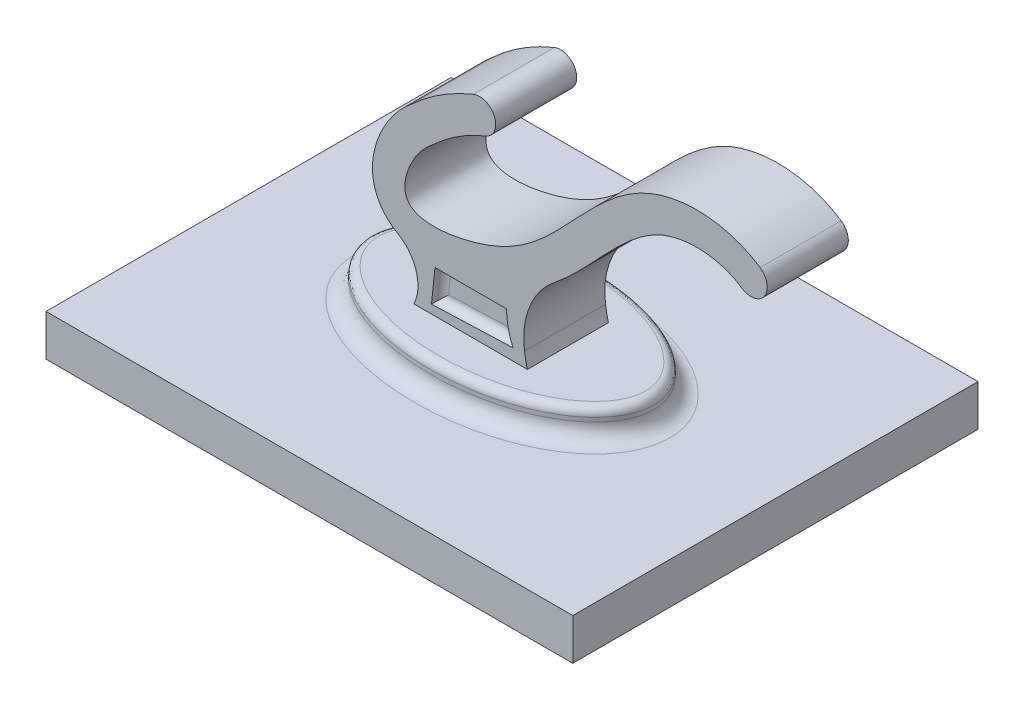
from build123d import *

# Parameters (mm, degrees)
BOSS_EXTRUDE1_DEPTH  = 5
SKETCH5_RX           = 17.5
SKETCH5_RY           = 10
BOSS_EXTRUDE4_DEPTH  = 3.5
SKETCH6_W            = 65
SKETCH6_H            = 50
BOSS_EXTRUDE5_DEPTH  = 5.10471724
CUT_EXTRUDE1_DEPTH   = 1
FILLET1_R            = 1
FILLET1_OF_MIRROR1_R = 1
FILLET2_R            = 1
FILLET3_R            = 10
FILLET4_START        = -5
FILLET4_DEPTH        = 10
FILLET5_R            = 2


with BuildPart() as part:
    # Sketch1 → Boss-Extrude1 (new, symmetric)
    with BuildSketch(Plane.XY):
        with BuildLine():
            add(Edge.make_bspline(
                [(-42.511448493, -19.515884819), (-41.183178468, -22.408372715), (-42.719767002, -25.24031189)],
                knots=[0, 0, 0, 1, 1, 1], degree=2))
            Line((-42.719767002, -25.24031189), (-28.710720076, -25.24031189))
            add(Edge.make_bspline(
                [(-27.547491004, -15.847538406), (-30.069104559, -20.108010021), (-28.710720076, -25.24031189)],
                knots=[0, 0, 0, 1, 1, 1], degree=2))
            add(Edge.make_bspline(
                [(-27.547491004, -15.847538406), (-27.693107353, -15.940822385), (-28.264730213, -16.298269412), (-29.483664506, -16.989369815), (-31.316256526, -17.843251684), (-33.534401516, -18.635056766), (-35.988441983, -19.283375181), (-38.642792909, -19.720500928), (-40.699902189, -19.779860279), (-42.024180926, -19.60949801), (-42.386794513, -19.541847042), (-42.511448493, -19.515884819)],
                knots=[0.56300718, 0.56300718, 0.56300718, 0.56300718, 0.570033901, 0.590244602, 0.618351488, 0.646458373, 0.674565259, 0.702672145, 0.730779031, 0.737565281, 0.741078642, 0.741078642, 0.741078642, 0.741078642], degree=3))
        make_face()
        with BuildLine():
            add(Edge.make_bspline(
                [(-42.511448493, -19.515884819), (-42.636102473, -19.489922596), (-42.887331899, -19.432227341), (-43.534661604, -19.253424197), (-44.597666409, -18.842797427), (-45.836596941, -18.006002518), (-46.772453373, -16.905139633), (-47.325073442, -15.921415058), (-47.663037862, -14.901222088), (-47.868098427, -13.630186416), (-47.813550522, -12.189145316), (-47.470372263, -10.624757554), (-46.924943549, -9.151691323), (-46.206717395, -7.746849394), (-45.322180994, -6.407972591), (-44.276311696, -5.156830424), (-43.437940558, -4.381521508), (-42.99756659, -4.032031584)],
                knots=[0.741078642, 0.741078642, 0.741078642, 0.741078642, 0.744592003, 0.748105363, 0.758885917, 0.772939359, 0.779966081, 0.786992802, 0.794019524, 0.801046245, 0.815099688, 0.829153131, 0.843206574, 0.857260017, 0.87131346, 0.885366903, 0.899420346, 0.899420346, 0.899420346, 0.899420346], degree=3))
            add(Edge.make_bspline(
                [(-27.547491004, -15.847538406), (-27.693107353, -15.940822385), (-28.264730213, -16.298269412), (-29.483664506, -16.989369815), (-31.316256526, -17.843251684), (-33.534401516, -18.635056766), (-35.988441983, -19.283375181), (-38.642792909, -19.720500928), (-40.699902189, -19.779860279), (-42.024180926, -19.60949801), (-42.386794513, -19.541847042), (-42.511448493, -19.515884819)],
                knots=[0.56300718, 0.56300718, 0.56300718, 0.56300718, 0.570033901, 0.590244602, 0.618351488, 0.646458373, 0.674565259, 0.702672145, 0.730779031, 0.737565281, 0.741078642, 0.741078642, 0.741078642, 0.741078642], degree=3))
            add(Edge.make_bspline(
                [(-2.224344566, -3.324498647), (-2.905624006, -2.868670451), (-4.376185748, -2.166937835), (-6.967392616, -1.663778837), (-9.668441391, -1.791572405), (-11.77198919, -2.389283508), (-13.297394838, -3.145944029), (-14.84863169, -4.131922848), (-16.797206994, -5.756193498), (-19.166707895, -8.167579935), (-21.614042986, -10.80849673), (-24.154437177, -13.337237691), (-26.233964049, -14.987750414), (-27.401874655, -15.754254427), (-27.547491004, -15.847538406)],
                knots=[0, 0, 0, 0, 0.056213772, 0.112427543, 0.168641315, 0.224855086, 0.252961972, 0.281068858, 0.33728263, 0.393496401, 0.449710173, 0.505923944, 0.555980458, 0.56300718, 0.56300718, 0.56300718, 0.56300718], degree=3))
            ThreePointArc((-2.224344566, -3.324498647), (0.55007704, -2.774421606), (0, 0))
            add(Edge.make_bspline(
                [(0, 0), (-3.995592997, 2.673358156), (-15.180096214, 3.17032538), (-24.42498552, -8.673292233), (-32.617415365, -15.187584878), (-44.458031911, -16.548233458), (-43.627257657, -10.773066777), (-41.633524958, -8.018810006), (-40.398542985, -7.077773665)],
                knots=[0, 0, 0, 0, 0.226825743, 0.465308755, 0.653750379, 0.78709749, 0.842182254, 0.90122142, 0.90122142, 0.90122142, 0.90122142], degree=3))
            add(Edge.make_bspline(
                [(-40.398542985, -7.077773665), (-37.497279915, -4.350318758), (-33.872206444, -2.876080959)],
                knots=[0, 0, 0, 1, 1, 1], degree=2))
            ThreePointArc((-33.872206444, -2.876080959), (-32.77298467, -0.26998973), (-35.379075899, 0.829232044))
            add(Edge.make_bspline(
                [(-42.99756659, -4.032031584), (-39.614957302, -0.896777436), (-35.379075899, 0.829232044)],
                knots=[0.02053743, 0.02053743, 0.02053743, 1, 1, 1], degree=2))
        make_face()
    extrude(amount=BOSS_EXTRUDE1_DEPTH, both=True)

    # Sketch5 → Boss-Extrude4 (add)
    with BuildSketch(Plane.XZ.offset(25.24031189)):
        with Locations(Location((-35.611084284, 0), (0, 0, 0))):
            Ellipse(SKETCH5_RX, SKETCH5_RY)
    extrude(amount=BOSS_EXTRUDE4_DEPTH)

    # Sketch6 → Boss-Extrude5 (add)
    with BuildSketch(Plane(origin=(0, -28.74031189, 0), x_dir=(-1, 0, 0), z_dir=(0, -1, 0))):
        with Locations((35.611084284, 0)):
            Rectangle(SKETCH6_W, SKETCH6_H)
    extrude(amount=BOSS_EXTRUDE5_DEPTH)

    # Sketch7 → Cut-Extrude1 (cut)
    with BuildSketch(Plane.XY.offset(5)):
        with BuildLine():
            Line((-40.111897138, -20.05530562), (-31.284205358, -20.05530562))
            ThreePointArc((-31.284205358, -20.05530562), (-31.080552853, -21.977637351), (-30.478636526, -23.814626834))
            Line((-30.478636526, -23.814626834), (-40.548246921, -24.183845882))
            Line((-40.548246921, -24.183845882), (-40.111897138, -20.05530562))
        make_face()
    cut_extrude1 = extrude(amount=-CUT_EXTRUDE1_DEPTH, mode=Mode.SUBTRACT)

    # Fillet1
    fillet1_edges = [part.edges().sort_by_distance(p)[0] for p in [
        (-35.698051248, -20.05530562, 4),
        (-31.080552853, -21.977637351, 4),
        (-35.513441724, -23.999236358, 4),
        (-40.33007203, -22.119575751, 4),
    ]]
    fillet(fillet1_edges, radius=FILLET1_R - 0.0001)  # a hair under: the kernel refuses the full size

    # Mirror1: Cut-Extrude1 across plane
    add(cut_extrude1.mirror(Plane.XY), mode=Mode.SUBTRACT)

    # Fillet1 of Mirror1
    fillet1_of_mirror1_edges = [part.edges().sort_by_distance(p)[0] for p in [
        (-35.698051248, -20.05530562, -4),
        (-31.080552853, -21.977637351, -4),
        (-35.513441724, -23.999236358, -4),
        (-40.33007203, -22.119575751, -4),
    ]]
    fillet(fillet1_of_mirror1_edges, radius=FILLET1_OF_MIRROR1_R - 0.0001)  # a hair under: the kernel refuses the full size

    # Fillet2
    fillet2_edges = [part.edges().sort_by_distance(p)[0] for p in [
        (-53.111000204, -25.24031189, -0.030998721),
    ]]
    fillet(fillet2_edges, radius=FILLET2_R)

    # Fillet3
    fillet3_edges = [part.edges().sort_by_distance(p)[0] for p in [
        (-27.547491004, -15.847538406, 2.5),
    ]]
    fillet(fillet3_edges, radius=FILLET3_R)

    # Fillet4: read off the stored shape, not the designer's step
    # Fillet4 outline → Fillet4 (add)
    with BuildSketch(Plane.XY.offset(FILLET4_START)):
        with BuildLine():
            add(Edge.make_bspline(
                [(-42.511448493, -19.515884819), (-42.636102473, -19.489922596), (-42.887331899, -19.432227341), (-43.534661604, -19.253424197), (-44.15437459, -19.014036058), (-44.65179344, -18.745229116), (-44.73714117, -18.696647872)],
                knots=[0.741078642, 0.741078642, 0.741078642, 0.741078642, 0.744592003, 0.748105363, 0.758885917, 0.76111801, 0.76111801, 0.76111801, 0.76111801], degree=3))
            ThreePointArc((-44.73714117, -18.696647872), (-42.432496855, -21.568943683), (-42.719767002, -25.24031189))
            add(Edge.make_bspline(
                [(-42.511448493, -19.515884819), (-41.183178468, -22.408372715), (-42.719767002, -25.24031189)],
                knots=[0, 0, 0, 1, 1, 1], degree=2))
        make_face()
    extrude(amount=FILLET4_DEPTH)

    # Fillet5
    fillet5_edges = [part.edges().sort_by_distance(p)[0] for p in [
        (-53.111000204, -28.74031189, -0.030998721),
    ]]
    fillet(fillet5_edges, radius=FILLET5_R)


solid = part.part
